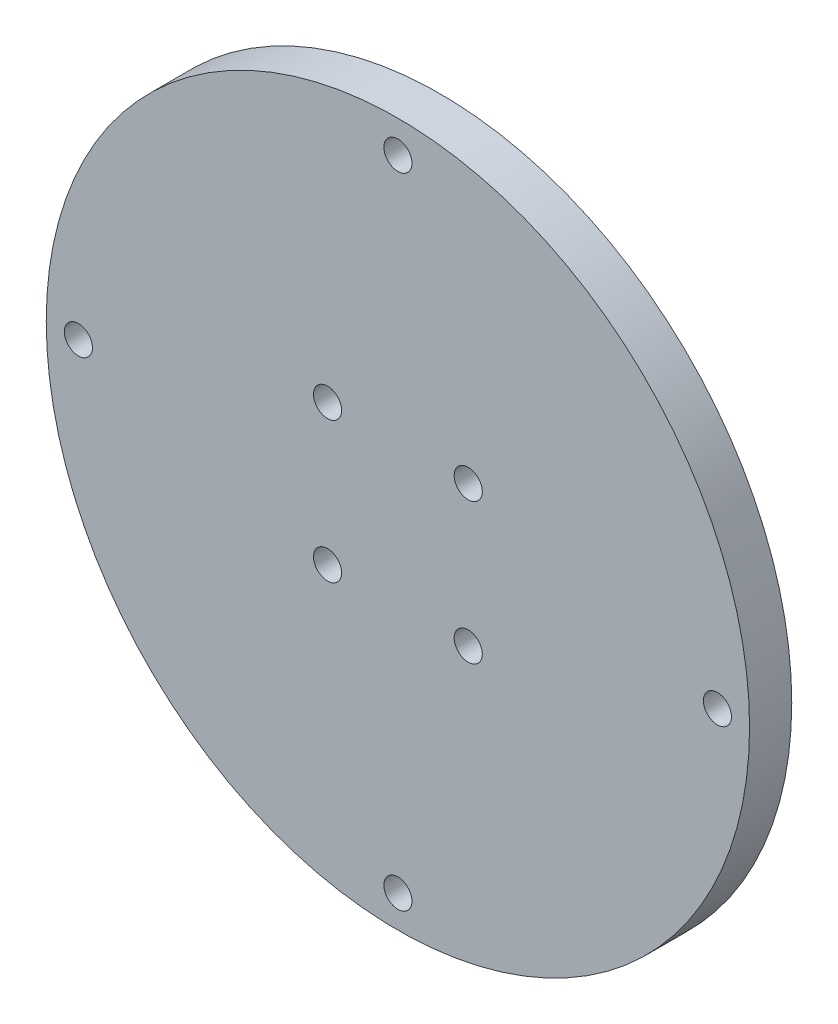
from build123d import *

# Parameters (mm, degrees)
SKETCH1_R           = 25
SKETCH1_R_2         = 1
BOSS_EXTRUDE1_DEPTH = 1.5


with BuildPart() as part:
    # Sketch1 → Boss-Extrude1 (new, symmetric)
    with BuildSketch(Plane.XY):
        Circle(SKETCH1_R)
        with Locations((5, 5)):
            Circle(SKETCH1_R_2, mode=Mode.SUBTRACT)
        with Locations((5, -5)):
            Circle(SKETCH1_R_2, mode=Mode.SUBTRACT)
        with Locations((-5, -5)):
            Circle(SKETCH1_R_2, mode=Mode.SUBTRACT)
        with Locations((-5, 5)):
            Circle(SKETCH1_R_2, mode=Mode.SUBTRACT)
        with Locations((0, -22.714)):
            Circle(SKETCH1_R_2, mode=Mode.SUBTRACT)
        with Locations((-22.714, 0)):
            Circle(SKETCH1_R_2, mode=Mode.SUBTRACT)
        with Locations((0, 22.714)):
            Circle(SKETCH1_R_2, mode=Mode.SUBTRACT)
        with Locations((22.714, 0)):
            Circle(SKETCH1_R_2, mode=Mode.SUBTRACT)
    extrude(amount=BOSS_EXTRUDE1_DEPTH, both=True)


solid = part.part
